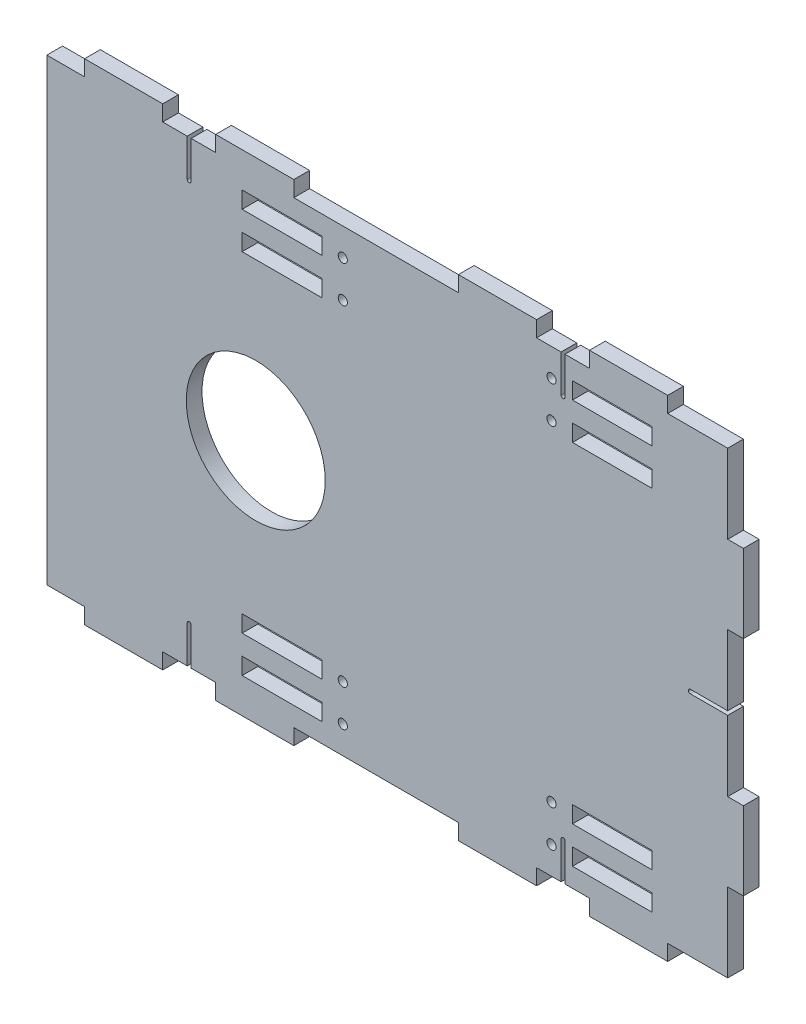
from build123d import *

# Parameters (mm, degrees)
ESBO_O1_W                = 270
ESBO_O1_H                = 187
RESSALTO_EXTRUS_O1_DEPTH = 6
ESBO_O2_W                = 30.1
ESBO_O2_H                = 6
ESBO_O2_W_2              = 20.2
ESBO_O2_W_3              = 62.783302492
ESBO_O2_W_4              = 18.716697508
CORTE_EXTRUS_O1_DEPTH    = 6
ESBO_O3_W                = 6
ESBO_O3_H                = 30.1
ESBO_O3_H_2              = 55.2
CORTE_EXTRUS_O2_DEPTH    = 6
ESBO_O4_W                = 0.75
ESBO_O4_H                = 15
ESBO_O4_W_2              = 1.5
ESBO_O4_W_3              = 15
ESBO_O4_H_2              = 1.5
CORTE_EXTRUS_O3_DEPTH    = 6
ESBO_O7_W                = 4.32
ESBO_O7_H                = 6
CORTE_EXTRUS_O4_DEPTH    = 194.4
ESBO_O8_W                = 30.4
ESBO_O8_H                = 6.4
ESBO_O8_R                = 1.75
CORTE_EXTRUS_O5_DEPTH    = 25.5
ESBO_O10_R               = 26.5
CORTE_EXTRUS_O6_DEPTH    = 25.5
FILETE1_R                = 0.75


with BuildPart() as part:
    # Esboço1 → Ressalto-extrusão1 (new body)
    with BuildSketch(Plane.XY):
        with Locations((135, 93.5)):
            Rectangle(ESBO_O1_W, ESBO_O1_H)
    extrude(amount=RESSALTO_EXTRUS_O1_DEPTH)

    # Esboço2 → Corte-extrusão1 (cut)
    with BuildSketch(Plane(origin=(0, 0, 0), x_dir=(-1, 0, 0), z_dir=(0, 0, -1))):
        with Locations((-256.15, 184)):
            Rectangle(ESBO_O2_W, ESBO_O2_H)
        with Locations((-201.2, 184)):
            Rectangle(ESBO_O2_W_2, ESBO_O2_H)
        with Locations((-129.908348754, 184)):
            Rectangle(ESBO_O2_W_3, ESBO_O2_H)
        with Locations((-58.616697508, 184)):
            Rectangle(ESBO_O2_W_2, ESBO_O2_H)
        with Locations((-9.358348754, 184)):
            Rectangle(ESBO_O2_W_4, ESBO_O2_H)
        with Locations((-9.358348754, 3)):
            Rectangle(ESBO_O2_W_4, ESBO_O2_H)
        with Locations((-58.616697508, 3)):
            Rectangle(ESBO_O2_W_2, ESBO_O2_H)
        with Locations((-129.908348754, 3)):
            Rectangle(ESBO_O2_W_3, ESBO_O2_H)
        with Locations((-201.2, 3)):
            Rectangle(ESBO_O2_W_2, ESBO_O2_H)
        with Locations((-256.15, 3)):
            Rectangle(ESBO_O2_W, ESBO_O2_H)
    extrude(amount=-CORTE_EXTRUS_O1_DEPTH, mode=Mode.SUBTRACT)

    # Esboço3 → Corte-extrusão2 (cut)
    with BuildSketch(Plane.XY.offset(6)):
        with Locations((267, 165.95)):
            Rectangle(ESBO_O3_W, ESBO_O3_H)
        with Locations((267, 93.5)):
            Rectangle(ESBO_O3_W, ESBO_O3_H_2)
        with Locations((267, 21.05)):
            Rectangle(ESBO_O3_W, ESBO_O3_H)
    extrude(amount=-CORTE_EXTRUS_O2_DEPTH, mode=Mode.SUBTRACT)

    # Esboço4 → Corte-extrusão3 (cut)
    with BuildSketch(Plane.XY.offset(6)):
        with Locations((58.241697508, 173.5)):
            Rectangle(ESBO_O4_W, ESBO_O4_H)
        with Locations((58.991697508, 173.5)):
            Rectangle(ESBO_O4_W, ESBO_O4_H)
        with Locations((58.241697508, 13.5)):
            Rectangle(ESBO_O4_W, ESBO_O4_H)
        with Locations((58.991697508, 13.5)):
            Rectangle(ESBO_O4_W, ESBO_O4_H)
        with Locations((201.2, 13.5)):
            Rectangle(ESBO_O4_W_2, ESBO_O4_H)
        with Locations((256.5, 93.5)):
            Rectangle(ESBO_O4_W_3, ESBO_O4_H_2)
        with Locations((201.2, 173.5)):
            Rectangle(ESBO_O4_W_2, ESBO_O4_H)
    extrude(amount=-CORTE_EXTRUS_O3_DEPTH, mode=Mode.SUBTRACT)

    # Esboço7 → Corte-extrusão4 (cut)
    with BuildSketch(Plane(origin=(0, 6, 0), x_dir=(1, 0, 0), z_dir=(0, 1, 0))):
        with Locations((2.16, -3)):
            Rectangle(ESBO_O7_W, ESBO_O7_H)
    extrude(amount=CORTE_EXTRUS_O4_DEPTH, mode=Mode.SUBTRACT)

    # Esboço8 → Corte-extrusão5 (cut)
    with BuildSketch(Plane.XY.offset(6)):
        with Locations((94, 30.5)):
            Rectangle(ESBO_O8_W, ESBO_O8_H)
        with Locations((94, 16.5)):
            Rectangle(ESBO_O8_W, ESBO_O8_H)
        with Locations((220, 16.5)):
            Rectangle(ESBO_O8_W, ESBO_O8_H)
        with Locations((220, 30.5)):
            Rectangle(ESBO_O8_W, ESBO_O8_H)
        with Locations((117.2, 30.5)):
            Circle(ESBO_O8_R)
        with Locations((117.2, 16.5)):
            Circle(ESBO_O8_R)
        with Locations((196.8, 30.5)):
            Circle(ESBO_O8_R)
        with Locations((196.8, 16.5)):
            Circle(ESBO_O8_R)
    corte_extrus_o5 = extrude(amount=-CORTE_EXTRUS_O5_DEPTH, mode=Mode.SUBTRACT)

    # Espelhar1: Corte-extrusão5 across plane
    add(corte_extrus_o5.mirror(Plane(origin=(0, 93.5, 0), x_dir=(0, 0, 1), z_dir=(0, -1, 0))), mode=Mode.SUBTRACT)

    # Esboço10 → Corte-extrusão6 (cut)
    with BuildSketch(Plane.XY.offset(6)):
        with Locations((84, 93.5)):
            Circle(ESBO_O10_R)
    extrude(amount=-CORTE_EXTRUS_O6_DEPTH, mode=Mode.SUBTRACT)

    # Filete1
    filete1_edges = [part.edges().sort_by_distance(p)[0] for p in [
        (59.366697508, 166, 3),
        (57.866697508, 166, 3),
        (200.45, 166, 3),
        (201.95, 166, 3),
        (249, 92.75, 3),
        (249, 94.25, 3),
        (201.95, 21, 3),
        (200.45, 21, 3),
        (57.866697508, 21, 3),
        (59.366697508, 21, 3),
    ]]
    fillet(filete1_edges, radius=FILETE1_R - 0.0001)  # a hair under: the kernel refuses the full size


solid = part.part
